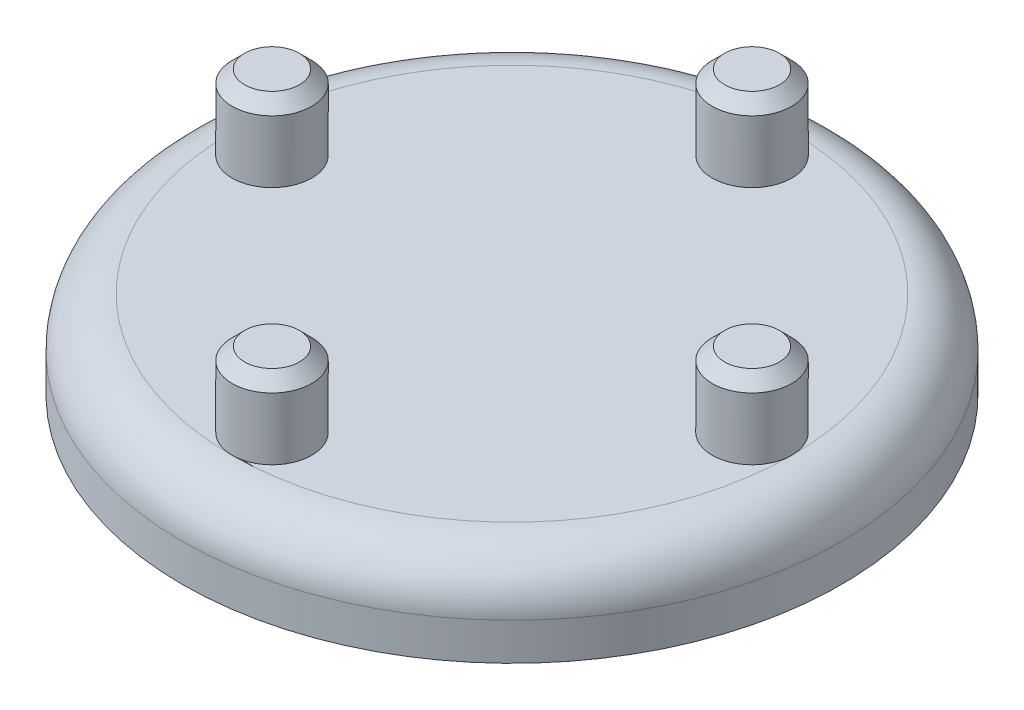
from build123d import *

# Parameters (mm, degrees)
SKETCH1_R           = 26.5
BOSS_EXTRUDE1_DEPTH = 7
BOSS_EXTRUDE4_START = 7
SKETCH1_12_R        = 3.2
BOSS_EXTRUDE4_DEPTH = 6
FILLET1_R           = 4
CHAMFER1_SIZE       = 1
BOSS_EXTRUDE5_START = 7
SKETCH1_16_R        = 3.2
BOSS_EXTRUDE5_DEPTH = 6
BOSS_EXTRUDE6_START = 7
SKETCH1_17_R        = 3.2
BOSS_EXTRUDE6_DEPTH = 6
CHAMFER2_SIZE       = 1


with BuildPart() as part:
    # Sketch1 → Boss-Extrude1 (new body)
    with BuildSketch(Plane(origin=(0, 0, 0), x_dir=(1, 0, 0), z_dir=(0, 1, 0))):
        with Locations(Location((0, 0, 0), (0, 0, 270))):
            Circle(SKETCH1_R)
    extrude(amount=BOSS_EXTRUDE1_DEPTH)

    # Sketch1<12> → Boss-Extrude4 (add)
    with BuildSketch(Plane(origin=(0, 0, 0), x_dir=(1, 0, 0), z_dir=(0, 1, 0)).offset(BOSS_EXTRUDE4_START)):
        with Locations(Location((19.3, 0, 0), (0, 0, 270))):
            Circle(SKETCH1_12_R)
        with Locations(Location((-19.3, 0, 0), (0, 0, 270))):
            Circle(SKETCH1_12_R)
    extrude(amount=BOSS_EXTRUDE4_DEPTH)

    # Fillet1
    fillet1_edges = [part.edges().sort_by_distance(p)[0] for p in [
        (0, 7, -26.5),
    ]]
    fillet(fillet1_edges, radius=FILLET1_R - 0.0001)  # a hair under: the kernel refuses the full size

    # Chamfer1
    chamfer1_edges = [part.edges().sort_by_distance(p)[0] for p in [
        (19.3, 13, -3.2),
        (-19.3, 13, -3.2),
    ]]
    chamfer(chamfer1_edges, length=CHAMFER1_SIZE)

    # Sketch1<16> → Boss-Extrude5 (add)
    with BuildSketch(Plane(origin=(0, 0, 0), x_dir=(1, 0, 0), z_dir=(0, 1, 0)).offset(BOSS_EXTRUDE5_START)):
        with Locations(Location((0, 19.3, 0), (0, 0, 89.999510926))):
            Circle(SKETCH1_16_R)
    extrude(amount=BOSS_EXTRUDE5_DEPTH)

    # Sketch1<17> → Boss-Extrude6 (add)
    with BuildSketch(Plane(origin=(0, 0, 0), x_dir=(1, 0, 0), z_dir=(0, 1, 0)).offset(BOSS_EXTRUDE6_START)):
        with Locations(Location((0, -19.3, 0), (0, 0, 269.999510926))):
            Circle(SKETCH1_17_R)
    extrude(amount=BOSS_EXTRUDE6_DEPTH)

    # Chamfer2
    chamfer2_edges = [part.edges().sort_by_distance(p)[0] for p in [
        (-2.7315e-05, 13, -16.1),
        (2.7315e-05, 13, 16.1),
    ]]
    chamfer(chamfer2_edges, length=CHAMFER2_SIZE)


solid = part.part
